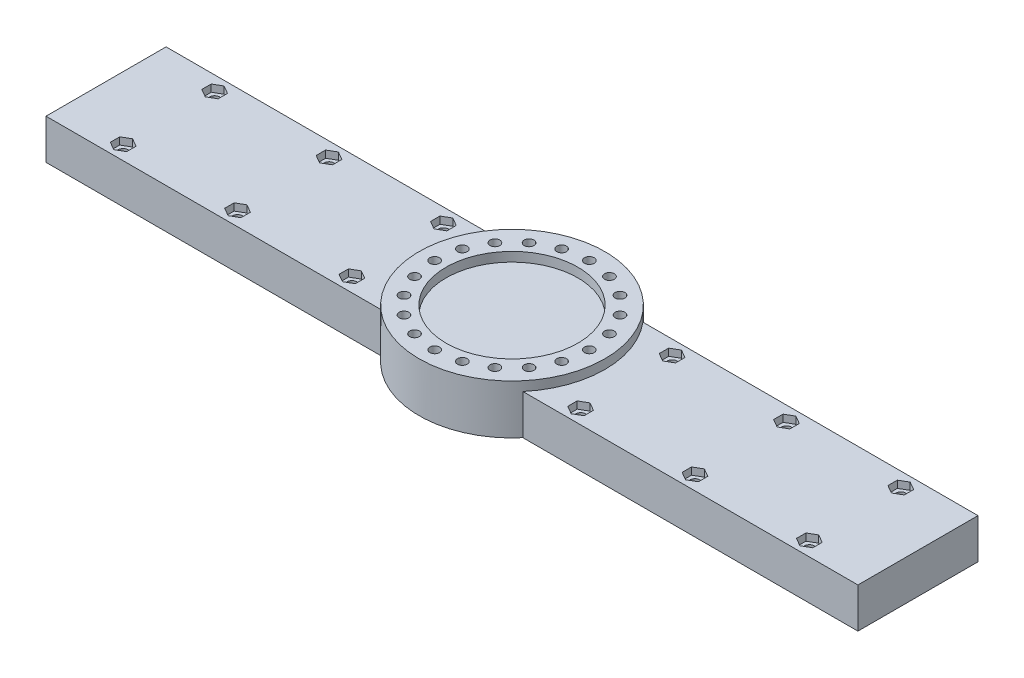
from build123d import *

# Parameters (mm, degrees)
SKETCH1_R                       = 32.5
BOSS_EXTRUDE1_DEPTH             = 10
SKETCH2_R                       = 23.05
CUT_EXTRUDE1_DEPTH              = 3.25
BOSS_EXTRUDE2_DEPTH             = 7.25
BOSS_EXTRUDE2_DEPTH_BACK        = 6.75
CBORE_FOR_M3_SBHCS1_D           = 3.4
CBORE_FOR_M3_SBHCS1_CBORE_D     = 6.7
CBORE_FOR_M3_SBHCS1_CBORE_DEPTH = 1.65
CUT_EXTRUDE3_DEPTH              = 2.5
SKETCH7_R                       = 1.7
CUT_EXTRUDE4_DEPTH              = 147.689510532


with BuildPart() as part:
    # Sketch1 → Boss-Extrude1 (new body)
    with BuildSketch(Plane(origin=(0, 0, 0), x_dir=(1, 0, 0), z_dir=(0, 1, 0))):
        Circle(SKETCH1_R)
    extrude(amount=BOSS_EXTRUDE1_DEPTH)

    # Sketch2 → Cut-Extrude1 (cut)
    with BuildSketch(Plane(origin=(0, 10, 0), x_dir=(1, 0, 0), z_dir=(0, 1, 0))):
        Circle(SKETCH2_R)
    extrude(amount=-CUT_EXTRUDE1_DEPTH, mode=Mode.SUBTRACT)

    # Sketch3 → Boss-Extrude2 (add, two sides: drawn at the far end of the back side and taken through both)
    with BuildSketch(Plane.XZ.offset(-BOSS_EXTRUDE2_DEPTH_BACK)):
        with BuildLine():
            Line((-142, 21), (-24.80423351, 21))
            ThreePointArc((-24.80423351, 21), (0, 32.5), (24.80423351, 21))
            Line((24.80423351, 21), (142, 21))
            Line((142, 21), (142, -21))
            Line((142, -21), (24.80423351, -21))
            ThreePointArc((24.80423351, -21), (0, -32.5), (-24.80423351, -21))
            Line((-24.80423351, -21), (-142, -21))
            Line((-142, -21), (-142, 21))
        make_face()
    extrude(amount=BOSS_EXTRUDE2_DEPTH + BOSS_EXTRUDE2_DEPTH_BACK)

    # CBORE for M3 SBHCS1 (through all)
    with Locations(Plane.XZ.offset(7.25)):
        with Locations((0, 27.05), (8.358909698, 25.726078766), (15.899591075, 21.883909698), (21.883909698, 15.899591075), (25.726078766, 8.358909698), (27.05, 0), (25.726078766, -8.358909698), (21.883909698, -15.899591075), (15.899591075, -21.883909698), (8.358909698, -25.726078766), (0, -27.05), (-8.358909698, -25.726078766), (-15.899591075, -21.883909698), (-21.883909698, -15.899591075), (-25.726078766, -8.358909698), (-27.05, 0), (-25.726078766, 8.358909698), (-21.883909698, 15.899591075), (-15.899591075, 21.883909698), (-8.358909698, 25.726078766)):
            CounterBoreHole(CBORE_FOR_M3_SBHCS1_D / 2, CBORE_FOR_M3_SBHCS1_CBORE_D / 2, CBORE_FOR_M3_SBHCS1_CBORE_DEPTH)

    # Sketch6 → Cut-Extrude3 (cut)
    with BuildSketch(Plane(origin=(0, 6.75, 0), x_dir=(1, 0, 0), z_dir=(0, 1, 0))):
        Polygon((-120, 19.290896534), (-122.85, 17.645448267), (-122.85, 14.354551733), (-120, 12.709103466), (-117.15, 14.354551733), (-117.15, 17.645448267), align=None)
        Polygon((-120, -12.709103466), (-122.85, -14.354551733), (-122.85, -17.645448267), (-120, -19.290896534), (-117.15, -17.645448267), (-117.15, -14.354551733), align=None)
        Polygon((-80, -12.709103466), (-82.85, -14.354551733), (-82.85, -17.645448267), (-80, -19.290896534), (-77.15, -17.645448267), (-77.15, -14.354551733), align=None)
        Polygon((-40, -12.709103466), (-42.85, -14.354551733), (-42.85, -17.645448267), (-40, -19.290896534), (-37.15, -17.645448267), (-37.15, -14.354551733), align=None)
        Polygon((-80, 19.290896534), (-82.85, 17.645448267), (-82.85, 14.354551733), (-80, 12.709103466), (-77.15, 14.354551733), (-77.15, 17.645448267), align=None)
        Polygon((-40, 19.290896534), (-42.85, 17.645448267), (-42.85, 14.354551733), (-40, 12.709103466), (-37.15, 14.354551733), (-37.15, 17.645448267), align=None)
        Polygon((40, 19.290896534), (37.15, 17.645448267), (37.15, 14.354551733), (40, 12.709103466), (42.85, 14.354551733), (42.85, 17.645448267), align=None)
        Polygon((80, 19.290896534), (77.15, 17.645448267), (77.15, 14.354551733), (80, 12.709103466), (82.85, 14.354551733), (82.85, 17.645448267), align=None)
        Polygon((120, 19.290896534), (117.15, 17.645448267), (117.15, 14.354551733), (120, 12.709103466), (122.85, 14.354551733), (122.85, 17.645448267), align=None)
        Polygon((120, -12.709103466), (117.15, -14.354551733), (117.15, -17.645448267), (120, -19.290896534), (122.85, -17.645448267), (122.85, -14.354551733), align=None)
        Polygon((80, -12.709103466), (77.15, -14.354551733), (77.15, -17.645448267), (80, -19.290896534), (82.85, -17.645448267), (82.85, -14.354551733), align=None)
        Polygon((40, -12.709103466), (37.15, -14.354551733), (37.15, -17.645448267), (40, -19.290896534), (42.85, -17.645448267), (42.85, -14.354551733), align=None)
    extrude(amount=-CUT_EXTRUDE3_DEPTH, mode=Mode.SUBTRACT)

    # Sketch7 → Cut-Extrude4 (cut, through all)
    with BuildSketch(Plane.XZ.offset(7.25)):
        with Locations((-120, 16)):
            Circle(SKETCH7_R)
        with Locations((-120, -16)):
            Circle(SKETCH7_R)
        with Locations((-80, -16)):
            Circle(SKETCH7_R)
        with Locations((-80, 16)):
            Circle(SKETCH7_R)
        with Locations((-40, 16)):
            Circle(SKETCH7_R)
        with Locations((-40, -16)):
            Circle(SKETCH7_R)
        with Locations((40, 16)):
            Circle(SKETCH7_R)
        with Locations((80, 16)):
            Circle(SKETCH7_R)
        with Locations((120, 16)):
            Circle(SKETCH7_R)
        with Locations((120, -16)):
            Circle(SKETCH7_R)
        with Locations((80, -16)):
            Circle(SKETCH7_R)
        with Locations((40, -16)):
            Circle(SKETCH7_R)
    extrude(amount=-CUT_EXTRUDE4_DEPTH, mode=Mode.SUBTRACT)


solid = part.part
